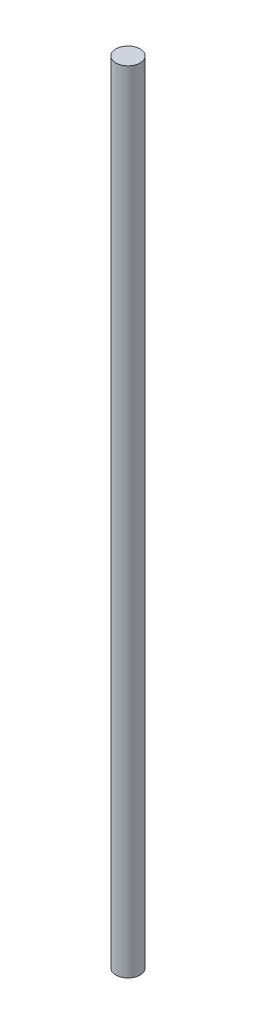
from build123d import *

# Parameters (mm, degrees)
SKETCH2_R           = 2
BOSS_EXTRUDE1_DEPTH = 130


with BuildPart() as part:
    # Sketch2 → Boss-Extrude1 (new body)
    with BuildSketch(Plane(origin=(0, 0, 0), x_dir=(1, 0, 0), z_dir=(0, 1, 0))):
        Circle(SKETCH2_R)
    extrude(amount=BOSS_EXTRUDE1_DEPTH)


solid = part.part
